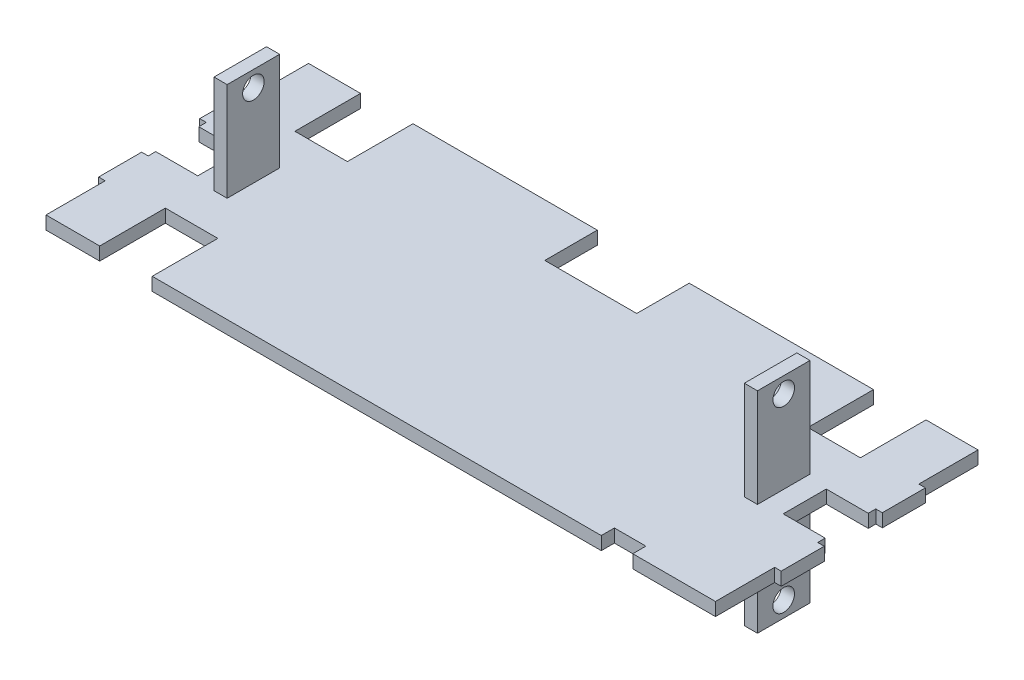
from build123d import *

# Parameters (mm, degrees)
BOSS_EXTRUDE1_DEPTH     = 3.175
SKETCH2_W               = 6.35
SKETCH2_H               = 25.4
BOSS_EXTRUDE2_DEPTH     = 50.8
CUT_EXTRUDE1_DEPTH      = 308.492808087
CUT_EXTRUDE1_DEPTH_BACK = 308.492808087
SKETCH3_R               = 5.207


with BuildPart() as part:
    # Sketch1 → Boss-Extrude1 (new, symmetric)
    with BuildSketch(Plane(origin=(0, 0, 0), x_dir=(1, 0, 0), z_dir=(0, 1, 0))):
        Polygon((161.925, -63.5), (121.92, -63.5), (121.92, -57.15), (106.68, -57.15), (106.68, -63.5), (-106.68, -63.5), (-110.5408, -63.5), (-110.5408, -31.75), (-135.9408, -31.75), (-135.9408, -63.5), (-161.925, -63.5), (-161.925, -34.874677354), (-165.1, -34.874677354), (-165.1, -14.046677354), (-161.925, -14.046677354), (-161.925, -10.414), (-141.605, -10.414), (-141.605, 10.414), (-161.925, 10.414), (-161.925, 14.046677354), (-165.1, 14.046677354), (-165.1, 34.874677354), (-161.925, 34.874677354), (-161.925, 63.5), (-136.779, 63.5), (-136.779, 31.75), (-111.379, 31.75), (-111.379, 63.5), (-22.228595254, 63.5), (-22.228595254, 38.1), (22.228595254, 38.1), (22.228595254, 63.5), (111.379, 63.5), (111.379, 31.75), (136.779, 31.75), (136.779, 63.5), (161.925, 63.5), (161.925, 34.874677354), (165.1, 34.874677354), (165.1, 14.046677354), (161.925, 14.046677354), (161.925, 10.414), (141.605, 10.414), (141.605, -10.414), (161.925, -10.414), (161.925, -14.046677354), (165.1, -14.046677354), (165.1, -34.874677354), (161.925, -34.874677354), align=None)
    extrude(amount=BOSS_EXTRUDE1_DEPTH, both=True)

    # Sketch2 → Boss-Extrude2 (add, symmetric)
    with BuildSketch(Plane(origin=(0, 0, 0), x_dir=(1, 0, 0), z_dir=(0, 1, 0))):
        with Locations((128.27, 0)):
            Rectangle(SKETCH2_W, SKETCH2_H)
        with Locations((-128.27, 0)):
            Rectangle(SKETCH2_W, SKETCH2_H)
    extrude(amount=BOSS_EXTRUDE2_DEPTH, both=True)

    # Sketch3 → Cut-Extrude1 (cut, two sides: drawn at the far end of the back side and taken through both)
    with BuildSketch(Plane.ZY.offset(131.445).offset(-CUT_EXTRUDE1_DEPTH_BACK)):
        with Locations((0, 43.18)):
            Circle(SKETCH3_R)
        with Locations((0, -43.18)):
            Circle(SKETCH3_R)
    extrude(amount=CUT_EXTRUDE1_DEPTH + CUT_EXTRUDE1_DEPTH_BACK, mode=Mode.SUBTRACT)


solid = part.part
